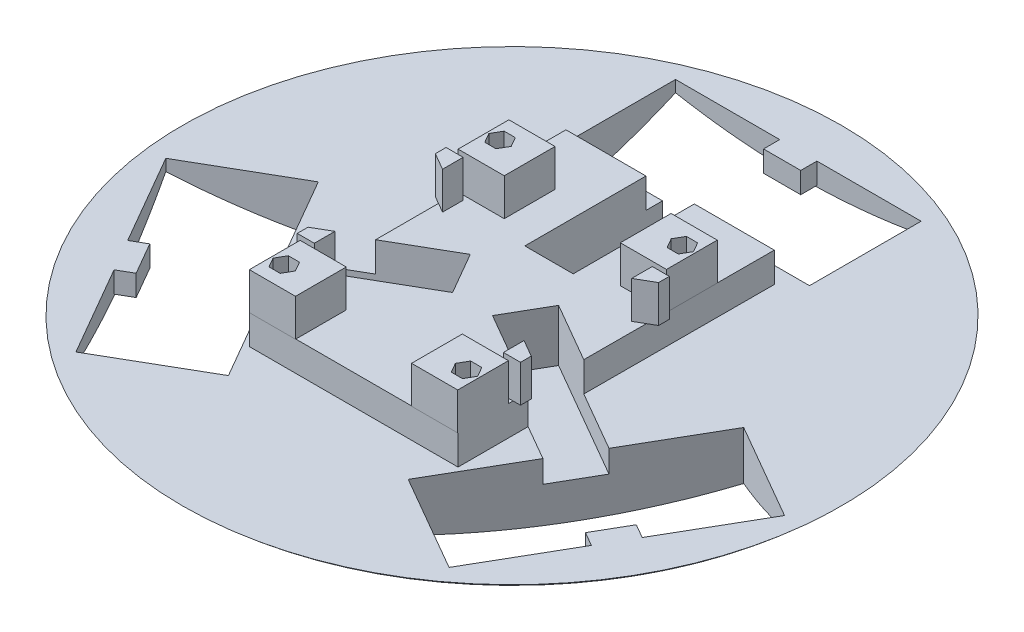
from build123d import *

# Parameters (mm, degrees)
SKETCH2_W           = 66
SKETCH2_H           = 30
CUT_EXTRUDE1_DEPTH  = 40
SKETCH4_W           = 13
SKETCH4_H           = 37
CUT_EXTRUDE2_DEPTH  = 6
BOSS_EXTRUDE1_DEPTH = 8
SKETCH6_W           = 12.402318472
SKETCH6_H           = 13.641488334
SKETCH6_H_2         = 13.641488333
BOSS_EXTRUDE2_DEPTH = 10
BOSS_EXTRUDE3_DEPTH = 10
SKETCH9_W           = 10
SKETCH9_H           = 5.665116272
BOSS_EXTRUDE4_DEPTH = 4.35
CIRPATTERN1_COUNT   = 3


with BuildPart() as part:
    # Sketch3 → Revolve1 (revolve)
    with BuildSketch(Plane(origin=(0, 0, 0), x_dir=(0, 0, -1), z_dir=(1, 0, 0))):
        with BuildLine():
            Line((0, 20), (0, 0))
            ThreePointArc((0, 0), (43.440585665, 3.508757487), (84.753971762, 17.38679738))
            ThreePointArc((84.753971762, 17.38679738), (86.762776598, 18.545504508), (88.56897203, 20))
            Line((88.56897203, 20), (0, 20))
        make_face()
    revolve(axis=Axis((0, 20, 0), (0, -1, 0)))

    # Sketch2 → Cut-Extrude1 (cut)
    with BuildSketch(Plane(origin=(0, 0, 0), x_dir=(1, 0, 0), z_dir=(0, 1, 0))):
        with Locations((0, 61.949465814)):
            Rectangle(SKETCH2_W, SKETCH2_H)
        Polygon((83.140192202, -9.895894582), (50.140192202, -67.053571232), (24.159430089, -52.053571232), (57.159430089, 5.104105418), align=None)
        Polygon((-50.140192202, -67.053571232), (-83.140192202, -9.895894582), (-57.159430089, 5.104105418), (-24.159430089, -52.053571232), align=None)
    extrude(amount=CUT_EXTRUDE1_DEPTH, mode=Mode.SUBTRACT)

    # Sketch4 → Cut-Extrude2 (cut)
    with BuildSketch(Plane(origin=(0, 20, 0), x_dir=(1, 0, 0), z_dir=(0, 1, 0))):
        with Locations((0, 28.449465814)):
            Rectangle(SKETCH4_W, SKETCH4_H)
        Polygon((37.409430089, -29.103898031), (43.909430089, -17.845567782), (11.866490149, 0.654432218), (5.366490149, -10.603898031), align=None)
        Polygon((-43.909430089, -17.845567782), (-37.409430089, -29.103898031), (-5.366490149, -10.603898031), (-11.866490149, 0.654432218), align=None)
    extrude(amount=-CUT_EXTRUDE2_DEPTH, mode=Mode.SUBTRACT)

    # Sketch5 → Boss-Extrude1 (add)
    with BuildSketch(Plane(origin=(0, 20, 0), x_dir=(1, 0, 0), z_dir=(0, 1, 0))):
        Polygon((-28, 42.5), (-6.5, 42.5), (-6.5, 9.949465814), (6.5, 9.949465814), (6.5, 42.5), (28, 42.5), (27.887960119, -8.595567782), (11.866490149, 0.654432218), (5.366490149, -10.603898031), (28, -23.671361037), (28, -42.5), (-28, -42.5), (-28, -23.671361037), (-5.366490149, -10.603898031), (-11.866490149, 0.654432218), (-28, -8.660254038), align=None)
    extrude(amount=BOSS_EXTRUDE1_DEPTH)

    # Sketch6 → Boss-Extrude2 (add)
    # profile 1 of 4: a face of its own
    with BuildSketch(Plane(origin=(0, 28, 0), x_dir=(1, 0, 0), z_dir=(0, 1, 0))):
        with Locations((-21.798840764, 20.339745962)):
            Rectangle(SKETCH6_W, SKETCH6_H)
        Polygon((-21.4977786, 21.28552155), (-22.9988893, 23.88552155), (-26.0011107, 23.88552155), (-27.5022214, 21.28552155), (-26.0011107, 18.68552155), (-22.9988893, 18.68552155), align=None, mode=Mode.SUBTRACT)
    # profile 2 of 4: a face of its own
    with BuildSketch(Plane(origin=(0, 28, 0), x_dir=(1, 0, 0), z_dir=(0, 1, 0))):
        with Locations((21.798840764, 20.339745962)):
            Rectangle(SKETCH6_W, SKETCH6_H)
        Polygon((21.4977786, 21.28552155), (22.9988893, 23.88552155), (26.0011107, 23.88552155), (27.5022214, 21.28552155), (26.0011107, 18.68552155), (22.9988893, 18.68552155), align=None, mode=Mode.SUBTRACT)
    # profile 3 of 4: a face of its own
    with BuildSketch(Plane(origin=(0, 28, 0), x_dir=(1, 0, 0), z_dir=(0, 1, 0))):
        with Locations((21.798840764, -35.768702862)):
            Rectangle(SKETCH6_W, SKETCH6_H_2)
        Polygon((26.0011107, -39.31447845), (27.5022214, -36.71447845), (26.0011107, -34.11447845), (22.9988893, -34.11447845), (21.4977786, -36.71447845), (22.9988893, -39.31447845), align=None, mode=Mode.SUBTRACT)
    # profile 4 of 4: a face of its own
    with BuildSketch(Plane(origin=(0, 28, 0), x_dir=(1, 0, 0), z_dir=(0, 1, 0))):
        with Locations((-21.798840764, -35.768702862)):
            Rectangle(SKETCH6_W, SKETCH6_H_2)
        Polygon((-21.4977786, -36.71447845), (-22.9988893, -39.31447845), (-26.0011107, -39.31447845), (-27.5022214, -36.71447845), (-26.0011107, -34.11447845), (-22.9988893, -34.11447845), align=None, mode=Mode.SUBTRACT)
    extrude(amount=BOSS_EXTRUDE2_DEPTH)

    # Sketch8 → Boss-Extrude3 (add)
    with BuildSketch(Plane(origin=(0, 28, 0), x_dir=(1, 0, 0), z_dir=(0, 1, 0))):
        Polygon((-25.413351143, -22.177958623), (-30, -24.826061575), (-30, -27.71447845), (-25.413351143, -27.71447845), align=None)
        Polygon((25.413351143, -27.71447845), (30, -27.71447845), (30, -24.826061575), (25.413351143, -22.177958623), align=None)
        Polygon((-30, 12.28552155), (-30, 9.397104676), (-25.413351143, 6.749001724), (-25.413351143, 12.28552155), align=None)
        Polygon((30, 9.397104676), (30, 12.28552155), (25.413351143, 12.28552155), (25.413351143, 6.749001724), align=None)
    extrude(amount=BOSS_EXTRUDE3_DEPTH)

    # Sketch9 → Boss-Extrude4 (add)
    with BuildSketch(Plane.XY.offset(-76.949465814)):
        with Locations((0, 17.167441864)):
            Rectangle(SKETCH9_W, SKETCH9_H)
    boss_extrude4 = extrude(amount=BOSS_EXTRUDE4_DEPTH)

    # CirPattern1: Boss-Extrude4 ×3 about axis
    cirpattern1_axis = Axis((0, 20, 0), (0, 1, 0))
    for i in range(1, CIRPATTERN1_COUNT):
        add(boss_extrude4.rotate(cirpattern1_axis, i * 360 / CIRPATTERN1_COUNT))


solid = part.part
